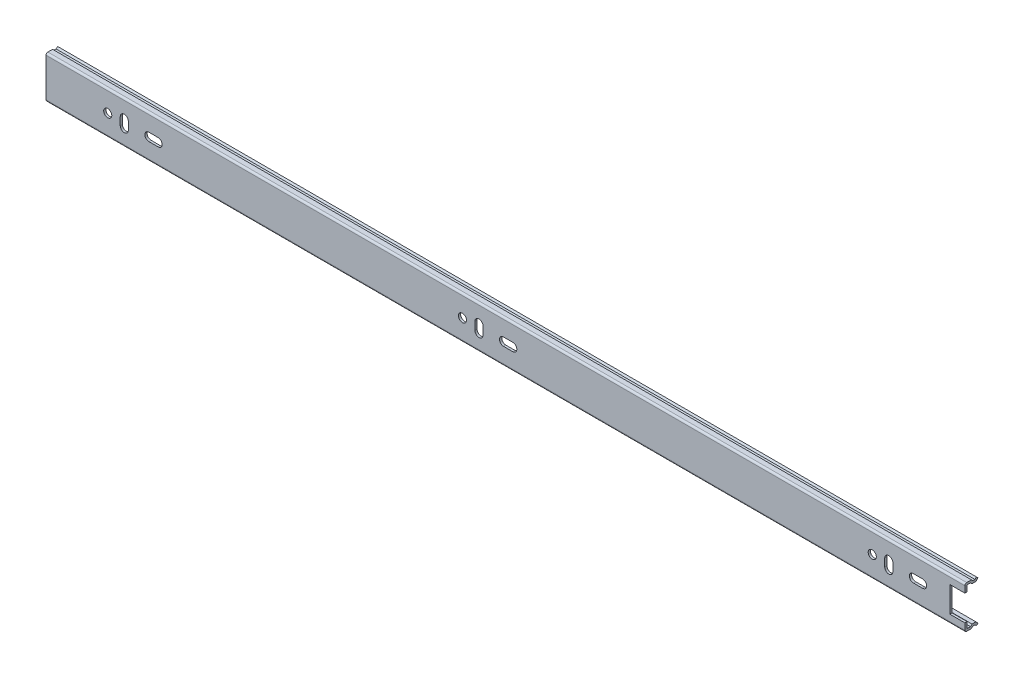
from build123d import *

# Parameters (mm, degrees)
EXTRUDE_3_DEPTH     = 500
SKETCH_2_R          = 2.2
SKETCH_2_W          = 8.2
SKETCH_2_H          = 14
CUT_EXTRUDE_1_DEPTH = 501.183317849


with BuildPart() as part:
    # Эскиз1 → Вытянуть-Тонкостенный3 (new body)
    with BuildSketch(Plane(origin=(0, 0, 0), x_dir=(0, 0, -1), z_dir=(1, 0, 0))):
        with BuildLine():
            Line((6.3, 11.5), (5.501920783, 10.701920783))
            Line((5.501920783, 10.701920783), (4.371381229, 10.701920783))
            Line((4.371381229, 10.701920783), (3.573302011, 11.5))
            Line((3.573302011, 11.5), (1, 11.5))
            ThreePointArc((1, 11.5), (0.292893219, 11.207106781), (0, 10.5))
            Line((0, 10.5), (0, -10.5))
            ThreePointArc((0, -10.5), (0.292893219, -11.207106781), (1, -11.5))
            Line((1, -11.5), (3.573302011, -11.5))
            Line((3.573302011, -11.5), (4.371381229, -10.701920783))
            Line((4.371381229, -10.701920783), (5.501920783, -10.701920783))
            Line((5.501920783, -10.701920783), (6.3, -11.5))
            Line((6.3, -11.5), (7.148528137, -10.651471863))
            Line((7.148528137, -10.651471863), (5.998977057, -9.501920783))
            Line((5.998977057, -9.501920783), (3.874324954, -9.501920783))
            Line((3.874324954, -9.501920783), (3.076245737, -10.3))
            Line((3.076245737, -10.3), (1.2, -10.3))
            Line((1.2, -10.3), (1.2, 10.3))
            Line((1.2, 10.3), (3.076245737, 10.3))
            Line((3.076245737, 10.3), (3.874324954, 9.501920783))
            Line((3.874324954, 9.501920783), (5.998977057, 9.501920783))
            Line((5.998977057, 9.501920783), (7.148528137, 10.651471863))
            Line((7.148528137, 10.651471863), (6.3, 11.5))
        make_face()
    extrude(amount=EXTRUDE_3_DEPTH)

    # Эскиз2 → Вырез-Вытянуть1 (cut, through all)
    with BuildSketch(Plane.XY):
        with Locations((449.6, 0)):
            Circle(SKETCH_2_R)
        with Locations((226.6, 0)):
            Circle(SKETCH_2_R)
        with Locations((33.6, 0)):
            Circle(SKETCH_2_R)
        with Locations((495.9, 0)):
            Rectangle(SKETCH_2_W, SKETCH_2_H)
        with BuildLine():
            Line((472, 2.2), (477, 2.2))
            ThreePointArc((477, 2.2), (479.2, 0), (477, -2.2))
            Line((477, -2.2), (472, -2.2))
            ThreePointArc((472, -2.2), (469.8, 0), (472, 2.2))
        make_face()
        with BuildLine():
            Line((456.4, 1.779598361), (456.4, -2.5))
            ThreePointArc((456.4, -2.5), (458.6, -4.7), (460.8, -2.5))
            Line((460.8, -2.5), (460.8, 1.779598361))
            ThreePointArc((460.8, 1.779598361), (458.6, 3.979598361), (456.4, 1.779598361))
        make_face()
        with BuildLine():
            Line((233.4, 1.779598361), (233.4, -2.5))
            ThreePointArc((233.4, -2.5), (235.6, -4.7), (237.8, -2.5))
            Line((237.8, -2.5), (237.8, 1.779598361))
            ThreePointArc((237.8, 1.779598361), (235.6, 3.979598361), (233.4, 1.779598361))
        make_face()
        with BuildLine():
            Line((249, -2.2), (254, -2.2))
            ThreePointArc((254, -2.2), (256.2, 0), (254, 2.2))
            Line((254, 2.2), (249, 2.2))
            ThreePointArc((249, 2.2), (246.8, 0), (249, -2.2))
        make_face()
        with BuildLine():
            Line((44.8, -2.5), (44.8, 1.779598361))
            ThreePointArc((44.8, 1.779598361), (42.6, 3.979598361), (40.4, 1.779598361))
            Line((40.4, 1.779598361), (40.4, -2.5))
            ThreePointArc((40.4, -2.5), (42.6, -4.7), (44.8, -2.5))
        make_face()
        with BuildLine():
            Line((56, 2.2), (61, 2.2))
            ThreePointArc((61, 2.2), (63.2, 0), (61, -2.2))
            Line((61, -2.2), (56, -2.2))
            ThreePointArc((56, -2.2), (53.8, 0), (56, 2.2))
        make_face()
    extrude(amount=-CUT_EXTRUDE_1_DEPTH, mode=Mode.SUBTRACT)


solid = part.part
